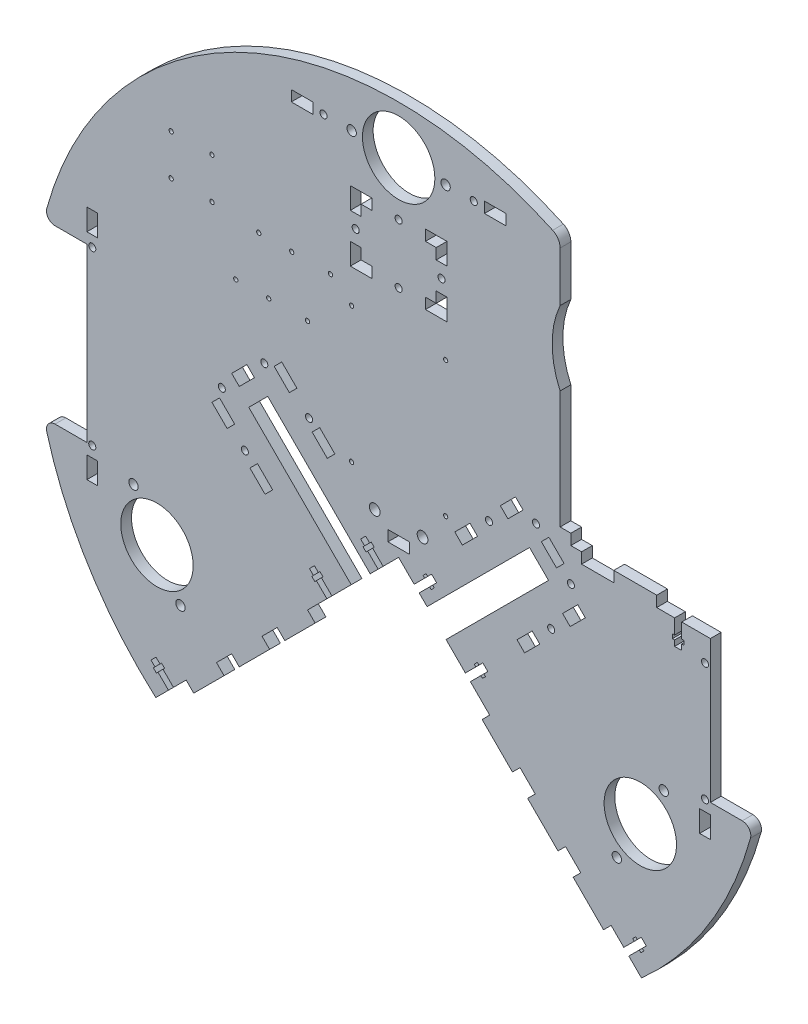
from build123d import *

# Parameters (mm, degrees)
SKETCH1_R                        = 215.9
BASE_PLATE_EXTRUSION_DEPTH       = 6.35
V_FUNNEL_CUT_DEPTH               = 306.394732273
SKETCH3_W                        = 25.4
SKETCH3_H                        = 50.8
WHEEL_TRACK_CUT_DEPTH            = 306.394732273
SILO_PICKER_CLEARANCE_DEPTH      = 302.140004815
V_FUNNEL_CORNER_DEPTH            = 6.35
SKETCH6_W                        = 6.35
SKETCH6_H                        = 25.4
V_FUNNEL_TAB_LEFT_DEPTH          = 6.35
V_FUNNEL_TAB_PATTERN_LEFT_COUNT  = 3
V_FUNNEL_TAB_PATTERN_LEFT_PITCH  = 38.1
SKETCH7_W                        = 6.35
SKETCH7_H                        = 25.4
V_FUNNEL_TAB_RIGHT_DEPTH         = 6.35
V_FUNNEL_TAB_PATTERN_RIGHT_COUNT = 3
V_FUNNEL_TAB_PATTERN_RIGHT_PITCH = 38.1
SILO_ARM_TAB_HOLES_DEPTH         = 6.35
DUMP_ARM_TAB_HOLES_DEPTH         = 6.35
SKETCH11_W                       = 6.35
SKETCH11_H                       = 12.7
WHEEL_SUPPORT_TAB_HOLES_DEPTH    = 6.35
SKETCH13_R                       = 21.43125
SKETCH13_R_2                     = 2.778125
CASTER_WHEEL_HOLE_DEPTH          = 302.140004815
SKETCH14_R                       = 2.0955
WHEEL_SUPPORT_HOLE_DEPTH         = 302.140004815
V_FUNNEL_T_SLOT_CUT_OUT_DEPTH    = 302.140004815
SKETCH19_R                       = 2.0955
SWITCH_PLATE_HOLES_DEPTH         = 302.140004815
SKETCH20_W                       = 12.7
SKETCH20_H                       = 6.35
SWITH_PLATE_TAB_HOLES_DEPTH      = 302.140004815
SKETCH26_R                       = 2.0955
SILO_ARM_HOLES_DEPTH             = 302.140004815
SKETCH27_R                       = 2.0955
DUMP_ARM_HOLES_DEPTH             = 302.140004815
WHEEL_SLOT_FILLET_R              = 5.08
SKETCH28_R                       = 21.43125
SKETCH28_R_2                     = 2.778125
FRONT_CASTER_HOLES_DEPTH         = 301.111238031
GYRO_HOLES_R                     = 1.27
GYROHOLES_DEPTH                  = 301.111238031
MOTORCONTROLLERHOLESKETCH_R      = 1.25
MOTOR_CONTROLLER_HOLE_DEPTH      = 301.111238031
SKETCH31_R                       = 1.27
BUCKCONVERTERHOLES_DEPTH         = 301.111238031
CUT_EXTRUDE6_DEPTH               = 301.111238031
SKETCH35_R                       = 2.0955
CUT_EXTRUDE7_DEPTH               = 301.111238031
CUT_EXTRUDE13_DEPTH              = 301.111238031
FILLET1_R                        = 7.62
CUT_EXTRUDE14_DEPTH              = 301.111238031
SKETCH44_W                       = 25.4
SKETCH44_H                       = 6.35
BOSS_EXTRUDE2_DEPTH              = 6.35
CUT_EXTRUDE15_DEPTH              = 301.111238031
SKETCH47_W                       = 12.7
SKETCH47_H                       = 6.35
CUT_EXTRUDE16_DEPTH              = 301.111238031
CUT_EXTRUDE11_DEPTH              = 301.111238031
SKETCH40_R                       = 2.0955
CUT_EXTRUDE12_DEPTH              = 301.111238031
SKETCH48_W                       = 12.7
SKETCH48_H                       = 6.35
BOSS_EXTRUDE3_DEPTH              = 6.35
SKETCH49_W                       = 6.35
SKETCH49_H                       = 6.35
BOSS_EXTRUDE4_DEPTH              = 6.35
CUT_EXTRUDE17_DEPTH              = 301.111238031
SKETCH51_R                       = 3.175
CUT_EXTRUDE18_DEPTH              = 301.111238031
SKETCH52_W                       = 25.4
SKETCH52_H                       = 6.35
BOSS_EXTRUDE5_DEPTH              = 6.35


with BuildPart() as part:
    # Sketch1 → Base Plate Extrusion (new body)
    with BuildSketch(Plane.XY):
        Circle(SKETCH1_R)
    extrude(amount=BASE_PLATE_EXTRUSION_DEPTH)

    # Sketch2 → V Funnel Cut (cut, through all)
    with BuildSketch(Plane.XY.offset(6.35)):
        with BuildLine():
            Line((0, -17.460836827), (143.684097937, -161.144934764))
            ThreePointArc((143.684097937, -161.144934764), (0, -215.9), (-143.684097937, -161.144934764))
            Line((-143.684097937, -161.144934764), (0, -17.460836827))
        make_face()
    extrude(amount=-V_FUNNEL_CUT_DEPTH, mode=Mode.SUBTRACT)

    # Sketch3 → Wheel Track Cut (cut, through all)
    with BuildSketch(Plane.XY.offset(6.35)):
        with BuildLine():
            Line((209.838437852, 50.8), (209.838437852, 0))
            Line((209.838437852, 0), (215.9, 0))
            ThreePointArc((215.9, 0), (214.379253581, 25.58018049), (209.838437852, 50.8))
        make_face()
        with BuildLine():
            Line((215.9, 0), (209.838437852, 0))
            Line((209.838437852, 0), (209.838437852, -50.8))
            ThreePointArc((209.838437852, -50.8), (214.379253581, -25.58018049), (215.9, 0))
        make_face()
        with Locations((197.138437852, 25.4)):
            Rectangle(SKETCH3_W, SKETCH3_H)
        with Locations((197.138437852, -25.4)):
            Rectangle(SKETCH3_W, SKETCH3_H)
    wheel_track_cut = extrude(amount=-WHEEL_TRACK_CUT_DEPTH, mode=Mode.SUBTRACT)

    # Wheel Track Cut Mirror: Wheel Track Cut across plane
    add(wheel_track_cut.mirror(Plane(origin=(0, 0, 0), x_dir=(0, 0, 1), z_dir=(1, 0, 0))), mode=Mode.SUBTRACT)

    # Sketch4 → Silo Picker Clearance (cut, through all)
    with BuildSketch(Plane.XY.offset(6.35)):
        Polygon((88.680029196, 15.092591612), (77.454709044, 26.317911764), (16.837980227, -34.298817054), (28.063300378, -45.524137205), align=None)
    silo_picker_clearance = extrude(amount=-SILO_PICKER_CLEARANCE_DEPTH, mode=Mode.SUBTRACT)

    # Sketch5 → V Funnel Corner (add)
    with BuildSketch(Plane.XY.offset(6.35)):
        Polygon((-4.490128061, -21.950964887), (0, -17.460836827), (4.490128061, -21.950964887), (0, -26.441092948), align=None)
    extrude(amount=-V_FUNNEL_CORNER_DEPTH)

    # Dump Picker Clearance: Silo Picker Clearance across plane
    add(silo_picker_clearance.mirror(Plane(origin=(0, 0, 0), x_dir=(0, 0, 1), z_dir=(1, 0, 0))), mode=Mode.SUBTRACT)

    # Sketch6 → V Funnel Tab Left (add)
    with BuildSketch(Plane(origin=(8.730418413, -8.730418413, 0), x_dir=(0, 0, -1), z_dir=(0.7071067811865467, -0.7071067811865485, 0))):
        with Locations((-3.175, -177.446676125)):
            Rectangle(SKETCH6_W, SKETCH6_H)
    v_funnel_tab_left = extrude(amount=V_FUNNEL_TAB_LEFT_DEPTH)

    # V Funnel Tab Pattern Left: V Funnel Tab Left ×3
    with Locations(*[Vector(0.7071067811865465, 0.7071067811865488, 0) * (i * V_FUNNEL_TAB_PATTERN_LEFT_PITCH) for i in range(1, V_FUNNEL_TAB_PATTERN_LEFT_COUNT)]):
        add(v_funnel_tab_left)

    # Sketch7 → V Funnel Tab Right (add)
    with BuildSketch(Plane(origin=(-8.730418413, -8.730418413, 0), x_dir=(0, 0, 1), z_dir=(-0.707106781186546, -0.707106781186549, 0))):
        with Locations((3.175, -177.446676125)):
            Rectangle(SKETCH7_W, SKETCH7_H)
    v_funnel_tab_right = extrude(amount=V_FUNNEL_TAB_RIGHT_DEPTH)

    # V Funnel Tab Pattern Right: V Funnel Tab Right ×3
    with Locations(*[Vector(-0.7071067811865469, 0.7071067811865481, 0) * (i * V_FUNNEL_TAB_PATTERN_RIGHT_PITCH) for i in range(1, V_FUNNEL_TAB_PATTERN_RIGHT_COUNT)]):
        add(v_funnel_tab_right)

    # Sketch8 → Silo Arm Tab Holes (cut)
    with BuildSketch(Plane(origin=(0, 0, 0), x_dir=(-1, 0, 0), z_dir=(0, 0, -1))):
        Polygon((-70.045997744, -24.645041723), (-79.026253865, -15.664785602), (-83.516381926, -20.154913663), (-74.536125805, -29.135169784), align=None)
        Polygon((-96.986766108, 2.29572664), (-101.476894168, -2.194401421), (-110.457150289, 6.7858547), (-105.967022229, 11.275982761), align=None)
        Polygon((-97.89653577, 28.32672534), (-88.916279649, 37.306981461), (-84.426151589, 32.816853401), (-93.40640771, 23.83659728), align=None)
        Polygon((-64.657844072, 34.624648676), (-60.167716011, 39.114776736), (-69.147972132, 48.095032857), (-73.638100193, 43.604904797), align=None)
        Polygon((-46.69733183, 16.664136433), (-42.207203769, 21.154264494), (-33.226947648, 12.174008373), (-37.717075708, 7.683880312), align=None)
    extrude(amount=-SILO_ARM_TAB_HOLES_DEPTH, mode=Mode.SUBTRACT)

    # Sketch10 → Dump Arm Tab Holes (cut)
    with BuildSketch(Plane(origin=(0, 0, 0), x_dir=(-1, 0, 0), z_dir=(0, 0, -1))):
        Polygon((51.18745989, 21.154264494), (42.207203769, 12.174008373), (37.717075708, 16.664136433), (46.69733183, 25.644392555), align=None)
        Polygon((64.657844072, 34.624648676), (60.167716011, 39.114776736), (69.147972132, 48.095032857), (73.638100193, 43.604904797), align=None)
        Polygon((89.802561211, 36.4206999), (85.31243315, 31.930571839), (94.292689271, 22.950315718), (98.782817332, 27.440443779), align=None)
        Polygon((105.967022229, 11.275982761), (96.986766108, 2.29572664), (101.476894168, -2.194401421), (110.457150289, 6.7858547), align=None)
        Polygon((88.006509986, -15.664785602), (83.516381926, -11.174657542), (74.536125805, -20.154913663), (79.026253865, -24.645041723), align=None)
    extrude(amount=-DUMP_ARM_TAB_HOLES_DEPTH, mode=Mode.SUBTRACT)

    # Sketch11 → Wheel Support Tab Holes (cut)
    with BuildSketch(Plane(origin=(0, 0, 0), x_dir=(-1, 0, 0), z_dir=(0, 0, -1))):
        with Locations((181.263437852, -63.5)):
            Rectangle(SKETCH11_W, SKETCH11_H)
        with Locations((181.263437852, 63.5)):
            Rectangle(SKETCH11_W, SKETCH11_H)
        with Locations((-181.263437852, -63.5)):
            Rectangle(SKETCH11_W, SKETCH11_H)
        with Locations((-181.263437852, 63.5)):
            Rectangle(SKETCH11_W, SKETCH11_H)
    extrude(amount=-WHEEL_SUPPORT_TAB_HOLES_DEPTH, mode=Mode.SUBTRACT)

    # Sketch13 → Caster Wheel Hole (cut, through all)
    with BuildSketch(Plane.XY.offset(6.35)):
        with Locations((0, 187.325)):
            Circle(SKETCH13_R)
        with Locations((27.78125, 187.325)):
            Circle(SKETCH13_R_2)
        with Locations((-27.78125, 187.325)):
            Circle(SKETCH13_R_2)
    extrude(amount=-CASTER_WHEEL_HOLE_DEPTH, mode=Mode.SUBTRACT)

    # Sketch14 → Wheel Support Hole (cut, through all)
    with BuildSketch(Plane.XY.offset(6.35)):
        with Locations((181.263437852, 50.8)):
            Circle(SKETCH14_R)
        with Locations((181.263437852, -50.8)):
            Circle(SKETCH14_R)
    wheel_support_hole = extrude(amount=-WHEEL_SUPPORT_HOLE_DEPTH, mode=Mode.SUBTRACT)

    # Wheel Support Hole Mirror: Wheel Support Hole across plane
    add(wheel_support_hole.mirror(Plane(origin=(0, 0, 0), x_dir=(0, 0, 1), z_dir=(1, 0, 0))), mode=Mode.SUBTRACT)

    # Sketch15 → V Funnel T Slot Cut Out (cut, through all)
    with BuildSketch(Plane.XY.offset(6.35)):
        Polygon((-136.185584076, -153.646420903), (-133.222099556, -150.682936383), (-139.41847628, -144.486559659), (-138.475549387, -143.543632766), (-140.271600611, -141.747581542), (-141.214527504, -142.690508435), (-143.549394095, -140.355641843), (-146.512878615, -143.319126363), (-144.178012024, -145.653992955), (-145.120938916, -146.596919848), (-143.324887692, -148.392971072), (-142.3819608, -147.450044179), align=None)
        Polygon((-42.454160812, -59.914997639), (-39.490676292, -56.951513119), (-45.687053016, -50.755136395), (-44.744126123, -49.812209503), (-46.540177347, -48.016158279), (-47.48310424, -48.959085171), (-49.817970832, -46.62421858), (-52.781455352, -49.5877031), (-50.44658876, -51.922569691), (-51.389515653, -52.865496584), (-49.593464429, -54.661547808), (-48.650537536, -53.718620915), align=None)
        Polygon((-12.145796404, -29.60663323), (-9.182311884, -26.64314871), (-15.378688607, -20.446771987), (-14.435761715, -19.503845094), (-16.231812939, -17.70779387), (-17.174739832, -18.650720763), (-19.509606423, -16.315854171), (-22.473090943, -19.279338691), (-20.138224351, -21.614205283), (-21.081151244, -22.557132175), (-19.28510002, -24.3531834), (-18.342173127, -23.410256507), align=None)
    v_funnel_t_slot_cut_out = extrude(amount=-V_FUNNEL_T_SLOT_CUT_OUT_DEPTH, mode=Mode.SUBTRACT)

    # V Funnel T Slot Cut Out Mirror: V Funnel T Slot Cut Out across plane
    add(v_funnel_t_slot_cut_out.mirror(Plane(origin=(0, 0, 0), x_dir=(0, 0, 1), z_dir=(1, 0, 0))), mode=Mode.SUBTRACT)

    # Sketch19 → Switch Plate Holes (cut, through all)
    with BuildSketch(Plane.XY.offset(6.35)):
        with Locations((44.45, 187.325)):
            Circle(SKETCH19_R)
        with Locations((-44.45, 187.325)):
            Circle(SKETCH19_R)
    extrude(amount=-SWITCH_PLATE_HOLES_DEPTH, mode=Mode.SUBTRACT)

    # Sketch20 → Swith Plate Tab Holes (cut, through all)
    with BuildSketch(Plane(origin=(0, 0, 0), x_dir=(-1, 0, 0), z_dir=(0, 0, -1))):
        with Locations((-57.15, 187.325)):
            Rectangle(SKETCH20_W, SKETCH20_H)
        with Locations((57.15, 187.325)):
            Rectangle(SKETCH20_W, SKETCH20_H)
    extrude(amount=-SWITH_PLATE_TAB_HOLES_DEPTH, mode=Mode.SUBTRACT)

    # Sketch26 → Silo Arm Holes (cut, through all)
    with BuildSketch(Plane.XY.offset(6.35)):
        with Locations((90.251574017, -8.929593512)):
            Circle(SKETCH26_R)
        with Locations((53.43252392, 27.889456585)):
            Circle(SKETCH26_R)
        with Locations((101.931779, 19.80135405)):
            Circle(SKETCH26_R)
        with Locations((81.277189921, 40.455943129)):
            Circle(SKETCH26_R)
    extrude(amount=-SILO_ARM_HOLES_DEPTH, mode=Mode.SUBTRACT)

    # Sketch27 → Dump Arm Holes (cut, through all)
    with BuildSketch(Plane.XY.offset(6.35)):
        with Locations((-52.983511114, 27.440443779)):
            Circle(SKETCH27_R)
        with Locations((-79.475266671, 42.257866379)):
            Circle(SKETCH27_R)
        with Locations((-104.61998381, 17.11314924)):
            Circle(SKETCH27_R)
        with Locations((-90.969994506, -8.211173022)):
            Circle(SKETCH27_R)
    extrude(amount=-DUMP_ARM_HOLES_DEPTH, mode=Mode.SUBTRACT)

    # Wheel Slot Fillet
    wheel_slot_fillet_edges = [part.edges().sort_by_distance(p)[0] for p in [
        (209.838437852, 50.8, 3.175),
        (209.838437852, -50.8, 3.175),
        (-209.838437852, -50.8, 3.175),
        (-209.838437852, 50.8, 3.175),
    ]]
    fillet(wheel_slot_fillet_edges, radius=WHEEL_SLOT_FILLET_R)

    # Sketch28 → Front Caster Holes (cut, through all)
    with BuildSketch(Plane.XY.offset(6.35)):
        with Locations((-142.980794165, -82.55)):
            Circle(SKETCH28_R)
        with Locations((-156.871419165, -58.490731751)):
            Circle(SKETCH28_R_2)
        with Locations((-129.090169165, -106.609268249)):
            Circle(SKETCH28_R_2)
    front_caster_holes = extrude(amount=-FRONT_CASTER_HOLES_DEPTH, mode=Mode.SUBTRACT)

    # Front Caster Hole Mirror: Front Caster Holes across plane
    add(front_caster_holes.mirror(Plane(origin=(0, 0, 0), x_dir=(0, 0, 1), z_dir=(1, 0, 0))), mode=Mode.SUBTRACT)

    # Gyro Holes → GyroHoles (cut, through all)
    with BuildSketch(Plane.XY.offset(6.35)):
        with Locations((-134.568187596, 133.592601438)):
            Circle(GYRO_HOLES_R)
        with Locations((-110.438187596, 133.592601438)):
            Circle(GYRO_HOLES_R)
        with Locations((-110.438187596, 109.462601438)):
            Circle(GYRO_HOLES_R)
        with Locations((-134.568187596, 109.462601438)):
            Circle(GYRO_HOLES_R)
    extrude(amount=-GYROHOLES_DEPTH, mode=Mode.SUBTRACT)

    # MotorControllerHoleSketch → Motor Controller Hole (cut, through all)
    with BuildSketch(Plane.XY.offset(6.35)):
        with Locations((-27.82, 97.614571151)):
            Circle(MOTORCONTROLLERHOLESKETCH_R)
        with Locations((27.82, 97.614571151)):
            Circle(MOTORCONTROLLERHOLESKETCH_R)
        with Locations((27.82, 17.574571151)):
            Circle(MOTORCONTROLLERHOLESKETCH_R)
        with Locations((-27.82, 17.574571151)):
            Circle(MOTORCONTROLLERHOLESKETCH_R)
    extrude(amount=-MOTOR_CONTROLLER_HOLE_DEPTH, mode=Mode.SUBTRACT)

    # Sketch31 → BuckConverterHoles (cut, through all)
    with BuildSketch(Plane.XY.offset(6.35)):
        with Locations((-76.88879011, 76.754063143)):
            Circle(SKETCH31_R)
        with Locations((-63.278477516, 107.506451461)):
            Circle(SKETCH31_R)
        with Locations((-53.919054985, 76.754063143)):
            Circle(SKETCH31_R)
        with Locations((-40.308742391, 107.506451461)):
            Circle(SKETCH31_R)
        with Locations((-82.735416804, 107.506451461)):
            Circle(SKETCH31_R)
        with Locations((-96.345729398, 76.754063143)):
            Circle(SKETCH31_R)
    extrude(amount=-BUCKCONVERTERHOLES_DEPTH, mode=Mode.SUBTRACT)

    # Sketch34 → Cut-Extrude6 (cut, through all)
    with BuildSketch(Plane(origin=(0, 0, 0), x_dir=(-1, 0, 0), z_dir=(0, 0, -1))):
        Polygon((-28.575, 158.75), (-15.875, 158.75), (-15.875, 152.4), (-22.225, 152.4), (-22.225, 146.05), (-28.575, 146.05), (-28.575, 152.4), align=None)
        Polygon((15.875, 158.75), (28.575, 158.75), (28.575, 152.4), (28.575, 146.05), (22.225, 146.05), (22.225, 152.4), (15.875, 152.4), align=None)
        Polygon((15.875, 123.825), (22.225, 123.825), (22.225, 130.175), (28.575, 130.175), (28.575, 123.825), (28.575, 117.475), (15.875, 117.475), align=None)
        Polygon((-22.225, 123.825), (-15.875, 123.825), (-15.875, 117.475), (-28.575, 117.475), (-28.575, 123.825), (-28.575, 130.175), (-22.225, 130.175), align=None)
    extrude(amount=-CUT_EXTRUDE6_DEPTH, mode=Mode.SUBTRACT)

    # Sketch35 → Cut-Extrude7 (cut, through all)
    with BuildSketch(Plane.XY.offset(6.35)):
        with Locations((0, 120.65)):
            Circle(SKETCH35_R)
        with Locations((25.4, 138.1125)):
            Circle(SKETCH35_R)
        with Locations((0, 155.575)):
            Circle(SKETCH35_R)
        with Locations((-25.4, 138.1125)):
            Circle(SKETCH35_R)
    extrude(amount=-CUT_EXTRUDE7_DEPTH, mode=Mode.SUBTRACT)

    # Sketch41 → Cut-Extrude13 (cut, through all)
    with BuildSketch(Plane.XY.offset(6.35)):
        Polygon((95.538437852, 193.610993729), (95.538437852, 45.87632042), (101.888437852, 45.87632042), (101.888437852, 39.52632042), (108.238437852, 39.52632042), (108.238437852, 33.17632042), (218.860535053, 33.17632042), (218.860535053, 193.610993729), align=None)
    extrude(amount=-CUT_EXTRUDE13_DEPTH, mode=Mode.SUBTRACT)

    # Fillet1
    fillet1_edges = [part.edges().sort_by_distance(p)[0] for p in [
        (95.538437852, 193.610993729, 3.175),
    ]]
    fillet(fillet1_edges, radius=FILLET1_R)

    # Sketch42 → Cut-Extrude14 (cut, through all)
    with BuildSketch(Plane.XY.offset(6.35)):
        with BuildLine():
            Line((95.538437852, 159.30810977), (95.538437852, 115.573937206))
            ThreePointArc((95.538437852, 115.573937206), (90.813693084, 137.441023488), (95.538437852, 159.30810977))
        make_face()
    extrude(amount=-CUT_EXTRUDE14_DEPTH, mode=Mode.SUBTRACT)

    # Sketch44 → Boss-Extrude2 (add)
    with BuildSketch(Plane(origin=(0, 33.17632042, 0), x_dir=(1, 0, 0), z_dir=(0, 1, 0))):
        with Locations((139.988437852, -3.175)):
            Rectangle(SKETCH44_W, SKETCH44_H)
    extrude(amount=BOSS_EXTRUDE2_DEPTH)

    # Sketch45 → Cut-Extrude15 (cut, through all)
    with BuildSketch(Plane.XY.offset(6.35)):
        Polygon((167.483937852, 33.17632042), (163.292937852, 33.17632042), (163.292937852, 24.41332042), (161.959437852, 24.41332042), (161.959437852, 21.87332042), (163.292937852, 21.87332042), (163.292937852, 18.57132042), (167.483937852, 18.57132042), (167.483937852, 21.87332042), (168.817437852, 21.87332042), (168.817437852, 24.41332042), (167.483937852, 24.41332042), align=None)
    extrude(amount=-CUT_EXTRUDE15_DEPTH, mode=Mode.SUBTRACT)

    # Sketch47 → Cut-Extrude16 (cut, through all)
    with BuildSketch(Plane(origin=(0, 0, 0), x_dir=(-1, 0, 0), z_dir=(0, 0, -1))):
        with Locations((0, -9.523336827)):
            Rectangle(SKETCH47_W, SKETCH47_H)
    extrude(amount=-CUT_EXTRUDE16_DEPTH, mode=Mode.SUBTRACT)

    # Sketch39 → Cut-Extrude11 (cut, through all)
    with BuildSketch(Plane(origin=(0, 0, 0), x_dir=(-1, 0, 0), z_dir=(0, 0, -1))):
        with BuildLine():
            Line((-184.438437852, 33.17632042), (-227.687563232, 33.17632042))
            ThreePointArc((-227.687563232, 33.17632042), (-211.381987161, 80.213964055), (-184.438437852, 122.07632042))
            Line((-184.438437852, 122.07632042), (-95.538437852, 122.07632042))
            Line((-95.538437852, 122.07632042), (-95.538437852, 33.17632042))
            Line((-95.538437852, 33.17632042), (-184.438437852, 33.17632042))
        make_face()
    extrude(amount=-CUT_EXTRUDE11_DEPTH, mode=Mode.SUBTRACT)

    # Sketch40 → Cut-Extrude12 (cut, through all)
    with BuildSketch(Plane.XY.offset(6.35)):
        with Locations((181.263437852, 19.05)):
            Circle(SKETCH40_R)
    extrude(amount=-CUT_EXTRUDE12_DEPTH, mode=Mode.SUBTRACT)

    # Sketch48 → Boss-Extrude3 (add)
    with BuildSketch(Plane(origin=(0, 33.17632042, 0), x_dir=(1, 0, 0), z_dir=(0, 1, 0))):
        with Locations((101.888437852, -3.175)):
            Rectangle(SKETCH48_W, SKETCH48_H)
    extrude(amount=BOSS_EXTRUDE3_DEPTH)

    # Sketch49 → Boss-Extrude4 (add)
    with BuildSketch(Plane(origin=(95.538437852, 0, 0), x_dir=(0, 0, -1), z_dir=(1, 0, 0))):
        with Locations((-3.175, 42.70132042)):
            Rectangle(SKETCH49_W, SKETCH49_H)
    extrude(amount=BOSS_EXTRUDE4_DEPTH)

    # Sketch50 → Cut-Extrude17 (cut, through all)
    with BuildSketch(Plane(origin=(0, 0, 0), x_dir=(-1, 0, 0), z_dir=(0, 0, -1))):
        Polygon((0, -17.460836827), (-4.490128061, -21.950964887), (0, -26.441092948), (4.490128061, -21.950964887), align=None)
    extrude(amount=-CUT_EXTRUDE17_DEPTH, mode=Mode.SUBTRACT)

    # Sketch51 → Cut-Extrude18 (cut, through all)
    with BuildSketch(Plane(origin=(0, 0, 0), x_dir=(-1, 0, 0), z_dir=(0, 0, -1))):
        with Locations((14.139243669, 0)):
            Circle(SKETCH51_R)
        with Locations((-14.139243669, 0)):
            Circle(SKETCH51_R)
    extrude(amount=-CUT_EXTRUDE18_DEPTH, mode=Mode.SUBTRACT)

    # Sketch52 → Boss-Extrude5 (add)
    with BuildSketch(Plane(origin=(0, 33.17632042, 0), x_dir=(1, 0, 0), z_dir=(0, 1, 0))):
        with Locations((139.988437852, -3.175)):
            Rectangle(SKETCH52_W, SKETCH52_H)
    extrude(amount=BOSS_EXTRUDE5_DEPTH)


solid = part.part
